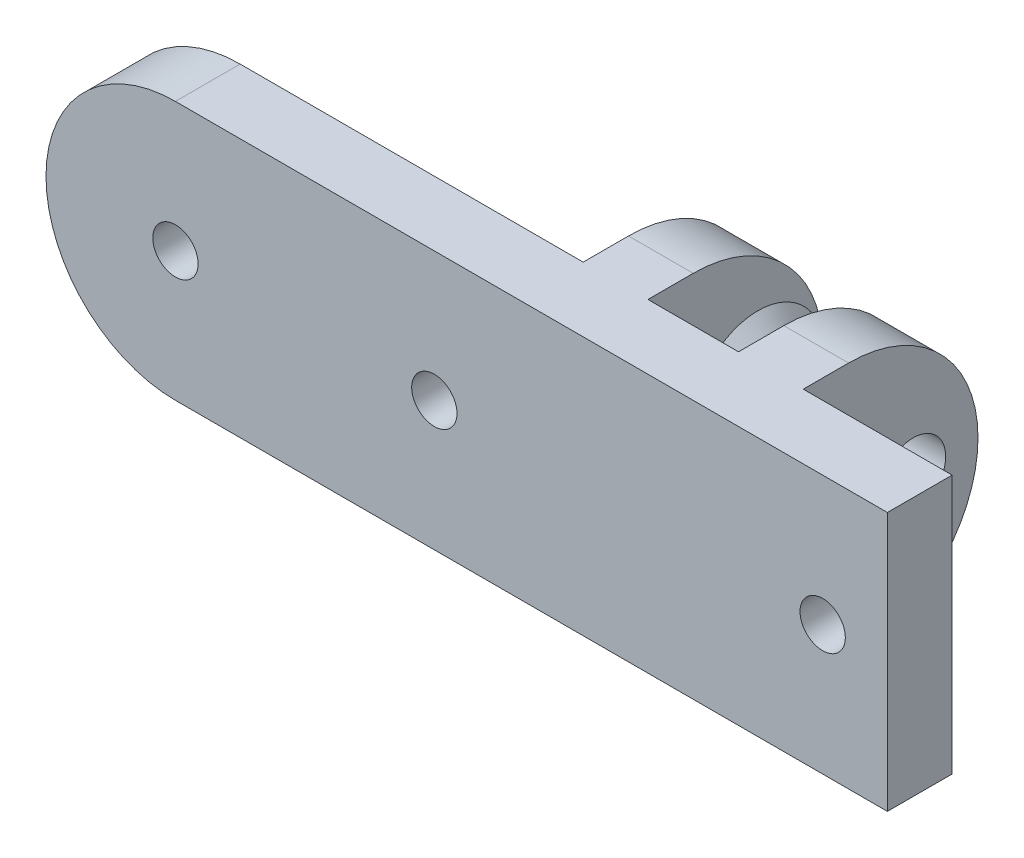
from build123d import *

# Parameters (mm, degrees)
SKETCH_1_W          = 16.5
SKETCH_1_H          = 20
SKETCH_1_R          = 1.75
SKETCH_1_W_2        = 7
SKETCH_1_W_3        = 25
EXTRUDE_1_DEPTH     = 5
SKETCH_2_W          = 5
SKETCH_2_H          = 20
EXTRUDE_2_DEPTH     = 13.5
SKETCH_3_R          = 2.5
CUT_EXTRUDE_1_DEPTH = 25
SKETCH_4_R          = 4
SKETCH_4_R_2        = 2.5
EXTRUDE_3_DEPTH     = 1
EXTRUDE_START       = 1
SKETCH_5_R          = 4
SKETCH_5_R_2        = 2.5
EXTRUDE_4_DEPTH     = 1
CHAMFER_1_SIZE      = 1
CHAMFER_2_SIZE      = 1
FILLET_1_R          = 10
FILLET_2_R          = 10
SKETCH_7_R          = 1.75
CUT_EXTRUDE_2_DEPTH = 5.5


with BuildPart() as part:
    # Эскиз1 → Бобышка-Вытянуть1 (new body)
    # profile 1 of 4: a face of its own
    with BuildSketch(Plane.XY):
        with Locations((-11.75, 0)):
            Rectangle(SKETCH_1_W, SKETCH_1_H)
        with Locations((-15, 0)):
            Circle(SKETCH_1_R, mode=Mode.SUBTRACT)
    # profile 2 of 4: a face of its own
    with BuildSketch(Plane.XY):
        with Locations((11.75, 0)):
            Rectangle(SKETCH_1_W, SKETCH_1_H)
        with Locations((15, 0)):
            Circle(SKETCH_1_R, mode=Mode.SUBTRACT)
    # profile 3 of 4: a face of its own
    with BuildSketch(Plane.XY):
        Rectangle(SKETCH_1_W_2, SKETCH_1_H)
    # profile 4 of 4: a face of its own
    with BuildSketch(Plane.XY):
        with Locations((-32.5, 0)):
            Rectangle(SKETCH_1_W_3, SKETCH_1_H)
    extrude(amount=EXTRUDE_1_DEPTH)

    # Эскиз2 → Бобышка-Вытянуть2 (add)
    with BuildSketch(Plane(origin=(0, 0, 0), x_dir=(-1, 0, 0), z_dir=(0, 0, -1))):
        with Locations((6, 0)):
            Rectangle(SKETCH_2_W, SKETCH_2_H)
        with Locations((-6, 0)):
            Rectangle(SKETCH_2_W, SKETCH_2_H)
    extrude(amount=EXTRUDE_2_DEPTH)

    # Эскиз3 → Вырез-Вытянуть1 (cut)
    with BuildSketch(Plane(origin=(8.5, 0, 0), x_dir=(0, 0, -1), z_dir=(1, 0, 0))):
        with Locations(Location((8.5, 0, 0), (0, 0, 90))):
            Circle(SKETCH_3_R)
    extrude(amount=-CUT_EXTRUDE_1_DEPTH, mode=Mode.SUBTRACT)

    # Эскиз4 → Бобышка-Вытянуть3 (add)
    with BuildSketch(Plane.ZY.offset(-3.5)):
        with Locations(Location((-8.5, 0, 0), (0, 0, 90))):
            Circle(SKETCH_4_R)
        with Locations(Location((-8.5, 0, 0), (0, 0, 90))):
            Circle(SKETCH_4_R_2, mode=Mode.SUBTRACT)
    extrude(amount=EXTRUDE_3_DEPTH)

    # Эскиз5 → Бобышка-Вытянуть4 (add)
    with BuildSketch(Plane(origin=(-3.5, 0, 0), x_dir=(0, 0, -1), z_dir=(1, 0, 0)).offset(EXTRUDE_START)):
        with Locations(Location((8.5, 0, 0), (0, 0, 90))):
            Circle(SKETCH_5_R)
        with Locations(Location((8.5, 0, 0), (0, 0, 90))):
            Circle(SKETCH_5_R_2, mode=Mode.SUBTRACT)
    extrude(amount=-EXTRUDE_4_DEPTH)

    # Фаска1
    chamfer_1_edges = [part.edges().sort_by_distance(p)[0] for p in [
        (-3.5, -4, -8.5),
    ]]
    chamfer(chamfer_1_edges, length=CHAMFER_1_SIZE - 0.0001)  # a hair under: the kernel refuses the full size

    # Фаска2
    chamfer_2_edges = [part.edges().sort_by_distance(p)[0] for p in [
        (3.5, -4, -8.5),
    ]]
    chamfer(chamfer_2_edges, length=CHAMFER_2_SIZE - 0.0001)  # a hair under: the kernel refuses the full size

    # Скругление1
    fillet_1_edges = [part.edges().sort_by_distance(p)[0] for p in [
        (6, 10, -13.5),
        (6, -10, -13.5),
    ]]
    fillet(fillet_1_edges, radius=FILLET_1_R - 0.0001)  # a hair under: the kernel refuses the full size

    # Скругление2
    fillet_2_edges = [part.edges().sort_by_distance(p)[0] for p in [
        (-6, 10, -13.5),
        (-6, -10, -13.5),
    ]]
    fillet(fillet_2_edges, radius=FILLET_2_R - 0.0001)  # a hair under: the kernel refuses the full size

    # Эскиз7 → Вырез-Вытянуть2 (cut)
    with BuildSketch(Plane.XY.offset(5)):
        with BuildLine():
            ThreePointArc((-45, -4.3e-08), (-42.071067826, 7.071067798), (-34.999999996, 10))
            Line((-34.999999996, 10), (-45, 10))
            Line((-45, 10), (-45, -4.3e-08))
        make_face()
        with BuildLine():
            Line((-45, -10), (-35, -10))
            ThreePointArc((-35, -10), (-42.071067797, -7.071067827), (-45, -4.3e-08))
            Line((-45, -4.3e-08), (-45, -10))
        make_face()
        with Locations((-35, 0)):
            Circle(SKETCH_7_R)
    extrude(amount=-CUT_EXTRUDE_2_DEPTH, mode=Mode.SUBTRACT)


solid = part.part
